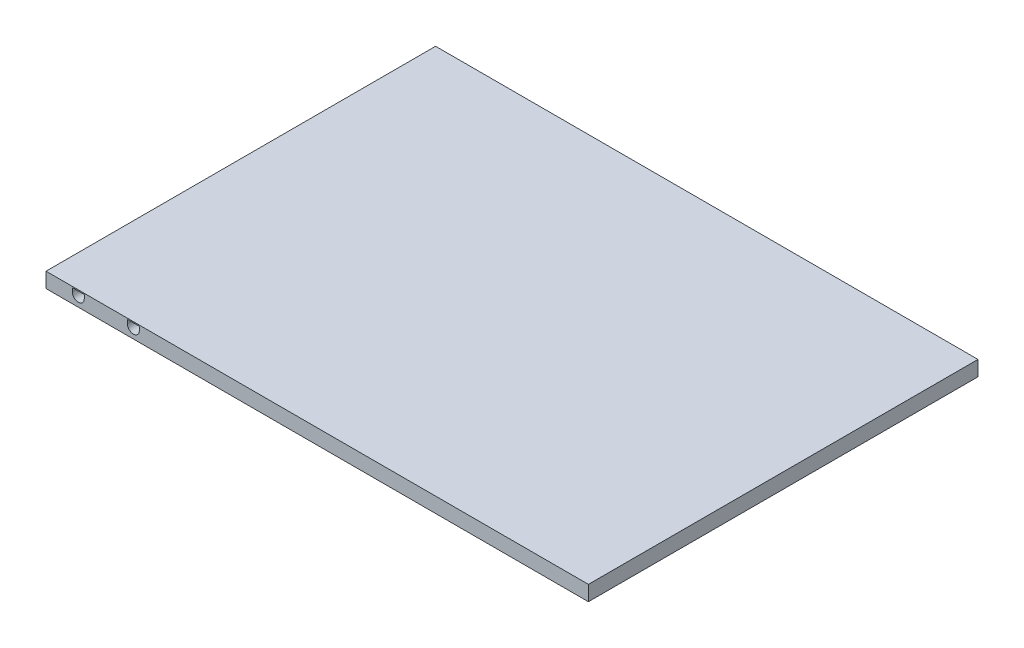
from build123d import *

# Parameters (mm, degrees)
SKETCH1_W           = 252
SKETCH1_H           = 181
BOSS_EXTRUDE1_DEPTH = 7


with BuildPart() as part:
    # Sketch1 → Boss-Extrude1 (new body)
    with BuildSketch(Plane(origin=(0, 0, 0), x_dir=(1, 0, 0), z_dir=(0, 1, 0))):
        Rectangle(SKETCH1_W, SKETCH1_H)
    extrude(amount=BOSS_EXTRUDE1_DEPTH)

    # Cut-Sweep1: sweep along a path in Sketch2
    with BuildLine(Plane(origin=(0, 7, 0), x_dir=(1, 0, 0), z_dir=(0, 1, 0))) as cut_sweep1_path:
        Line((-111, -90.5), (-111, 67.225))
        ThreePointArc((-111, 67.225), (-106.350320151, 78.450320151), (-95.125, 83.1))
        Line((-95.125, 83.1), (100.125, 83.1))
        ThreePointArc((100.125, 83.1), (116, 67.225), (100.125, 51.35))
        Line((100.125, 51.35), (-69.875, 51.35))
        ThreePointArc((-69.875, 51.35), (-85.75, 35.475), (-69.875, 19.6))
        Line((-69.875, 19.6), (100.125, 19.6))
        ThreePointArc((100.125, 19.6), (116, 3.725), (100.125, -12.15))
        Line((100.125, -12.15), (-69.875, -12.15))
        ThreePointArc((-69.875, -12.15), (-85.75, -28.025), (-69.875, -43.9))
        Line((-69.875, -43.9), (100.125, -43.9))
        ThreePointArc((100.125, -43.9), (115.658333333, -59.433333333), (100.125, -74.966666667))
        Line((100.125, -74.966666667), (-69.875, -74.966666667))
        ThreePointArc((-69.875, -74.966666667), (-80.858725334, -79.516274666), (-85.408333333, -90.5))
    # Sketch3 → Cut-Sweep1 (sweep, cut)
    with BuildSketch(Plane.XY.offset(90.5)):
        with BuildLine():
            Line((-114.175, 4.775), (-114.175, 7))
            Line((-114.175, 7), (-107.825, 7))
            Line((-107.825, 7), (-107.825, 4.775))
            ThreePointArc((-107.825, 4.775), (-111, 1.6), (-114.175, 4.775))
        make_face()
    sweep(path=cut_sweep1_path.line, mode=Mode.SUBTRACT)

    # Sweep1: sweep along a path in Sketch2<2>
    with BuildLine(Plane(origin=(0, 7, 0), x_dir=(1, 0, 0), z_dir=(0, 1, 0))) as sweep1_path:
        Line((-111, -90.5), (-111, 67.225))
        ThreePointArc((-111, 67.225), (-106.350320151, 78.450320151), (-95.125, 83.1))
        Line((-95.125, 83.1), (100.125, 83.1))
        ThreePointArc((100.125, 83.1), (116, 67.225), (100.125, 51.35))
        Line((100.125, 51.35), (-69.875, 51.35))
        ThreePointArc((-69.875, 51.35), (-85.75, 35.475), (-69.875, 19.6))
        Line((-69.875, 19.6), (100.125, 19.6))
        ThreePointArc((100.125, 19.6), (116, 3.725), (100.125, -12.15))
        Line((100.125, -12.15), (-69.875, -12.15))
        ThreePointArc((-69.875, -12.15), (-85.75, -28.025), (-69.875, -43.9))
        Line((-69.875, -43.9), (100.125, -43.9))
        ThreePointArc((100.125, -43.9), (115.658333333, -59.433333333), (100.125, -74.966666667))
        Line((100.125, -74.966666667), (-69.875, -74.966666667))
        ThreePointArc((-69.875, -74.966666667), (-80.858725334, -79.516274666), (-85.408333333, -90.5))
    # Sketch4 → Sweep1 (sweep)
    with BuildSketch(Plane.XY.offset(90.5)):
        with BuildLine():
            Line((-114.175, 4.775), (-114.175, 7))
            Line((-114.175, 7), (-107.825, 7))
            Line((-107.825, 7), (-107.825, 4.775))
            ThreePointArc((-107.825, 4.775), (-111, 1.6), (-114.175, 4.775))
        make_face()
        with BuildLine():
            Line((-113.778125, 4.775), (-113.778125, 6.5))
            Line((-113.778125, 6.5), (-108.221875, 6.5))
            Line((-108.221875, 6.5), (-108.221875, 4.775))
            ThreePointArc((-108.221875, 4.775), (-111, 1.996875), (-113.778125, 4.775))
        make_face(mode=Mode.SUBTRACT)
    sweep(path=sweep1_path.line)


solid = part.part
